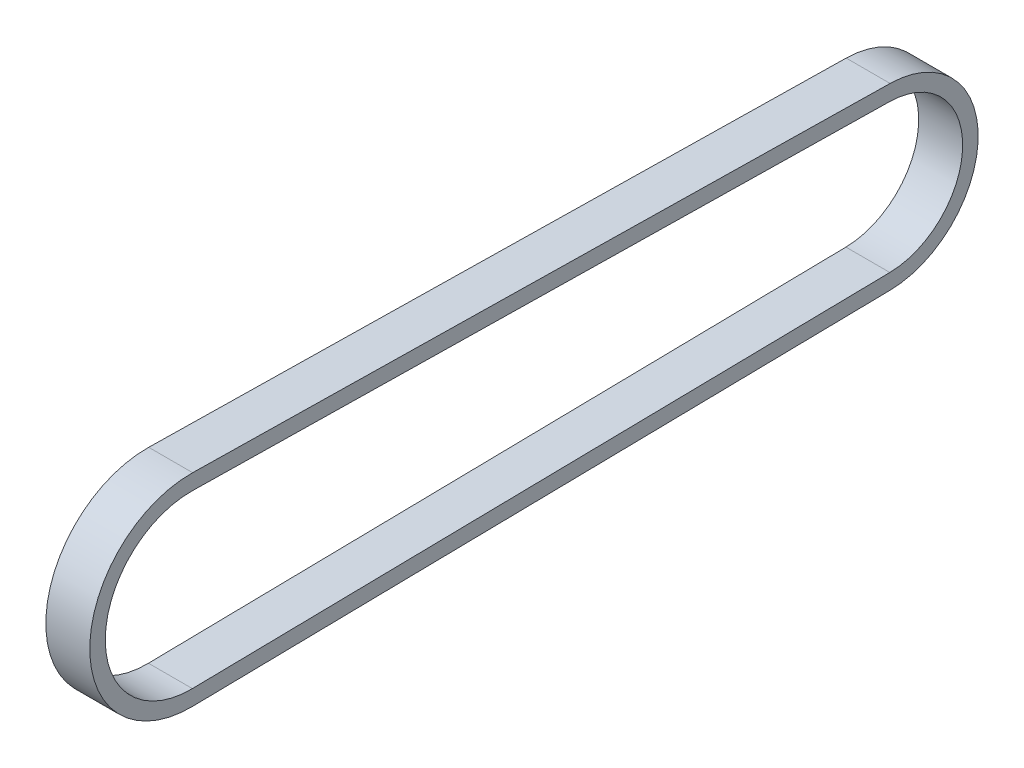
from build123d import *

# Parameters (mm, degrees)
BOSS_EXTRUDE1_DEPTH = 4.5


with BuildPart() as part:
    # Sketch1 → Boss-Extrude1 (new, symmetric)
    with BuildSketch(Plane(origin=(0, 0, 0), x_dir=(0, 0, -1), z_dir=(1, 0, 0))):
        with BuildLine():
            Line((0.345950303, 20.720972267), (143.181135701, 18.336244609))
            ThreePointArc((143.181135701, 18.336244609), (161.2138, 0), (143.181135701, -18.336244609))
            Line((143.181135701, -18.336244609), (0.345950303, -20.720972267))
            ThreePointArc((0.345950303, -20.720972267), (-20.72386, 0), (0.345950303, 20.720972267))
        make_face()
        with BuildLine():
            Line((0.29294897, 17.546414682), (143.128134368, 15.161687025))
            ThreePointArc((143.128134368, 15.161687025), (158.0388, 0), (143.128134368, -15.161687025))
            Line((143.128134368, -15.161687025), (0.29294897, -17.546414682))
            ThreePointArc((0.29294897, -17.546414682), (-17.54886, 0), (0.29294897, 17.546414682))
        make_face(mode=Mode.SUBTRACT)
    extrude(amount=BOSS_EXTRUDE1_DEPTH, both=True)


solid = part.part
